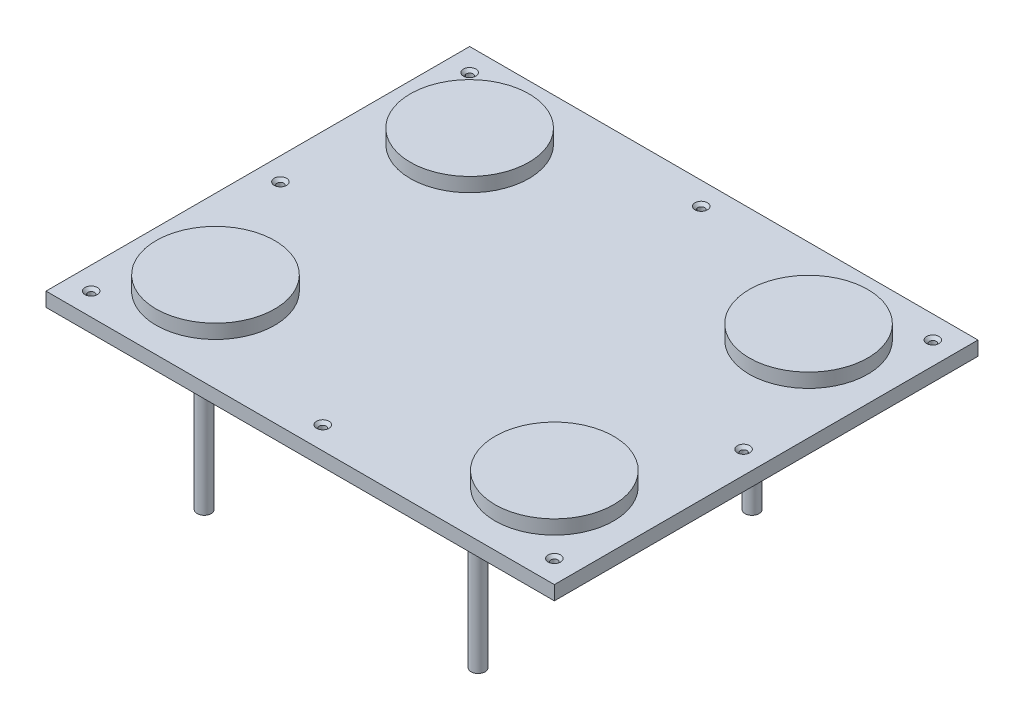
from build123d import *

# Parameters (mm, degrees)
SKETCH1_W                                       = 180
SKETCH1_H                                       = 150
BOSS_EXTRUDE1_DEPTH                             = 5
CSK_FOR_M2_FLAT_HEAD_MACHINE_SCREW1_D           = 2.4
CSK_FOR_M2_FLAT_HEAD_MACHINE_SCREW1_CSINK_D     = 4.4
CSK_FOR_M2_FLAT_HEAD_MACHINE_SCREW1_CSINK_ANGLE = 90
SKETCH5_R                                       = 21
BOSS_EXTRUDE3_DEPTH                             = 5
SKETCH6_R                                       = 2.5
BOSS_EXTRUDE4_DEPTH                             = 60
F_1_0MM_DOWEL_HOLE1_OUTLINE_R                   = 0.5
F_1_0MM_DOWEL_HOLE1_DEPTH                       = 5


# Read off the part's stored shape, not the designer's step: Ø1.0mm Dowel Hole1
with BuildPart() as part:
    # Sketch1 → Boss-Extrude1 (new body)
    with BuildSketch(Plane(origin=(0, 0, 0), x_dir=(1, 0, 0), z_dir=(0, 1, 0))):
        Rectangle(SKETCH1_W, SKETCH1_H)
    extrude(amount=BOSS_EXTRUDE1_DEPTH)

    # CSK for M2 Flat Head Machine Screw1 (through all)
    with Locations(Plane(origin=(-82, 5, -67), x_dir=(0, 0, 1), z_dir=(0, 1, 0))):
        with Locations((0, 0), (67, 0), (134, 0), (134, 82), (134, 164), (67, 164), (0, 164), (0, 82)):
            CounterSinkHole(CSK_FOR_M2_FLAT_HEAD_MACHINE_SCREW1_D / 2, CSK_FOR_M2_FLAT_HEAD_MACHINE_SCREW1_CSINK_D / 2, counter_sink_angle=CSK_FOR_M2_FLAT_HEAD_MACHINE_SCREW1_CSINK_ANGLE)

    # Sketch5 → Boss-Extrude3 (add)
    with BuildSketch(Plane(origin=(0, 5, 0), x_dir=(1, 0, 0), z_dir=(0, 1, 0))):
        with Locations(Location((-60, -45, 0), (0, 0, 270))):
            Circle(SKETCH5_R)
        with Locations(Location((-60, 45, 0), (0, 0, 270))):
            Circle(SKETCH5_R)
        with Locations(Location((60, 45, 0), (0, 0, 270))):
            Circle(SKETCH5_R)
        with Locations(Location((60, -45, 0), (0, 0, 270))):
            Circle(SKETCH5_R)
    extrude(amount=BOSS_EXTRUDE3_DEPTH)

    # Sketch6 → Boss-Extrude4 (add)
    with BuildSketch(Plane(origin=(0, 0, 0), x_dir=(-1, 0, 0), z_dir=(0, -1, 0))):
        with Locations(Location((60, 48, 0), (0, 0, 270))):
            Circle(SKETCH6_R)
        with Locations(Location((60, -49, 0), (0, 0, 270))):
            Circle(SKETCH6_R)
        with Locations(Location((-37, 48, 0), (0, 0, 270))):
            Circle(SKETCH6_R)
        with Locations(Location((-37, -49, 0), (0, 0, 270))):
            Circle(SKETCH6_R)
    extrude(amount=BOSS_EXTRUDE4_DEPTH)

    # Ø1.0mm Dowel Hole1 outline → Ø1.0mm Dowel Hole1 (cut)
    with BuildSketch(Plane(origin=(0, 0, 0), x_dir=(1, 0, 0), z_dir=(0, 1, 0))):
        with Locations((37, -49)):
            Circle(F_1_0MM_DOWEL_HOLE1_OUTLINE_R)
    extrude(amount=F_1_0MM_DOWEL_HOLE1_DEPTH, mode=Mode.SUBTRACT)

    # 1.0mm Dowel Hole1 2 outline → 1.0mm Dowel Hole1 2 (revolve, cut)
    with BuildSketch(Plane(origin=(37, 0, -48), x_dir=(1, 0, 0), z_dir=(0, 0, 1))):
        Polygon((0.5, -30), (0, -29.69956969), (0, -60), (0.5, -60), align=None)
    revolve(axis=Axis((37, 0, -48), (0, 1, 0)), mode=Mode.SUBTRACT)

    # 1.0mm Dowel Hole1 3 outline → 1.0mm Dowel Hole1 3 (revolve, cut)
    with BuildSketch(Plane(origin=(-60, 0, 49), x_dir=(1, 0, 0), z_dir=(0, 0, 1))):
        Polygon((0.5, -30), (0, -29.69956969), (0, -60), (0.5, -60), align=None)
    revolve(axis=Axis((-60, 0, 49), (0, 1, 0)), mode=Mode.SUBTRACT)

    # 1.0mm Dowel Hole1 4 outline → 1.0mm Dowel Hole1 4 (revolve, cut)
    with BuildSketch(Plane(origin=(-60, 0, -48), x_dir=(1, 0, 0), z_dir=(0, 0, 1))):
        Polygon((0.5, -30), (0, -29.69956969), (0, -60), (0.5, -60), align=None)
    revolve(axis=Axis((-60, 0, -48), (0, 1, 0)), mode=Mode.SUBTRACT)


solid = part.part
